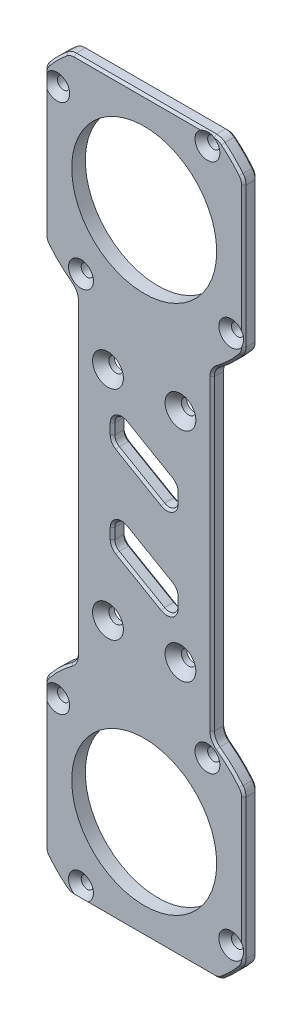
from build123d import *

# Parameters (mm, degrees)
SKETCH_1_R                     = 15.25
EXTRUDE_1_DEPTH                = 3
FILLET_1_R                     = 3
HOLE_WIZARD_M2_5_1_D           = 2.7
HOLE_WIZARD_M2_5_1_DEPTH       = 3
HOLE_WIZARD_M2_5_1_CSINK_D     = 5.5
HOLE_WIZARD_M2_5_1_CSINK_ANGLE = 90
HOLE_WIZARD_M2_5_1_TIP         = 0.811161836
CUT_EXTRUDE_1_DEPTH            = 10
FILLET_2_R                     = 2
HOLE_WIZARD_M3_2_D             = 3.2
HOLE_WIZARD_M3_2_DEPTH         = 3
HOLE_WIZARD_M3_2_CSINK_D       = 6.8
HOLE_WIZARD_M3_2_CSINK_ANGLE   = 90
HOLE_WIZARD_M3_2_TIP           = 0.96137699
SKETCH_8_R                     = 16
CUT_EXTRUDE_2_DEPTH            = 10
CHAMFER_1_SIZE                 = 0.5
CHAMFER_2_SIZE                 = 0.5


with BuildPart() as part:
    # 草图1 → 凸台-拉伸1 (new body)
    # profile 1 of 7: a face of its own
    with BuildSketch(Plane.XY):
        with BuildLine():
            ThreePointArc((15, 35.451138857), (0, 31), (-15, 35.451138857))
            Line((-15, 35.451138857), (-15, -35.451138857))
            ThreePointArc((-15, -35.451138857), (0, -31), (15, -35.451138857))
            Line((15, -35.451138857), (15, 35.451138857))
        make_face()
    # profile 2 of 7: a face of its own
    with BuildSketch(Plane.XY):
        with BuildLine():
            ThreePointArc((15, 35.451138857), (15.758728611, 35.963086445), (16.5, 36.5))
            Line((16.5, 36.5), (15, 36.5))
            Line((15, 36.5), (15, 35.451138857))
        make_face()
    # profile 3 of 7: a face of its own
    with BuildSketch(Plane.XY):
        with BuildLine():
            Line((-15, 36.5), (-16.5, 36.5))
            ThreePointArc((-16.5, 36.5), (-15.758728611, 35.963086445), (-15, 35.451138857))
            Line((-15, 35.451138857), (-15, 36.5))
        make_face()
    # profile 4 of 7: a face of its own
    with BuildSketch(Plane.XY):
        with BuildLine():
            Line((-15, -36.5), (-15, -35.451138857))
            ThreePointArc((-15, -35.451138857), (-15.758728611, -35.963086445), (-16.5, -36.5))
            Line((-16.5, -36.5), (-15, -36.5))
        make_face()
    # profile 5 of 7: a face of its own
    with BuildSketch(Plane.XY):
        with BuildLine():
            ThreePointArc((16.5, -36.5), (15.758728611, -35.963086445), (15, -35.451138857))
            Line((15, -35.451138857), (15, -36.5))
            Line((15, -36.5), (16.5, -36.5))
        make_face()
    # profile 6 of 7: a face of its own
    with BuildSketch(Plane.XY):
        with BuildLine():
            ThreePointArc((15, -35.451138857), (0, -31), (-15, -35.451138857))
            Line((-15, -35.451138857), (-15, -36.5))
            Line((-15, -36.5), (-16.5, -36.5))
            ThreePointArc((-16.5, -36.5), (-19.445436483, -39.054563517), (-22, -42))
            Line((-22, -42), (-22, -75))
            ThreePointArc((-22, -75), (-19.445436483, -77.945436483), (-16.5, -80.5))
            Line((-16.5, -80.5), (16.5, -80.5))
            ThreePointArc((16.5, -80.5), (19.445436483, -77.945436483), (22, -75))
            Line((22, -75), (22, -42))
            ThreePointArc((22, -42), (19.445436483, -39.054563517), (16.5, -36.5))
            Line((16.5, -36.5), (15, -36.5))
            Line((15, -36.5), (15, -35.451138857))
        make_face()
        with Locations((0, -58.5)):
            Circle(SKETCH_1_R, mode=Mode.SUBTRACT)
    # profile 7 of 7: a face of its own
    with BuildSketch(Plane.XY):
        with BuildLine():
            Line((16.5, 80.5), (-16.5, 80.5))
            ThreePointArc((-16.5, 80.5), (-19.445436483, 77.945436483), (-22, 75))
            Line((-22, 75), (-22, 42))
            ThreePointArc((-22, 42), (-19.445436483, 39.054563517), (-16.5, 36.5))
            Line((-16.5, 36.5), (-15, 36.5))
            Line((-15, 36.5), (-15, 35.451138857))
            ThreePointArc((-15, 35.451138857), (0, 31), (15, 35.451138857))
            Line((15, 35.451138857), (15, 36.5))
            Line((15, 36.5), (16.5, 36.5))
            ThreePointArc((16.5, 36.5), (19.445436483, 39.054563517), (22, 42))
            Line((22, 42), (22, 75))
            ThreePointArc((22, 75), (19.445436483, 77.945436483), (16.5, 80.5))
        make_face()
        with Locations((0, 58.5)):
            Circle(SKETCH_1_R, mode=Mode.SUBTRACT)
    extrude(amount=EXTRUDE_1_DEPTH)

    # 圆角1
    fillet_1_edges = [part.edges().sort_by_distance(p)[0] for p in [
        (-22, 42, 1.5),
        (-22, 75, 1.5),
        (-16.5, 80.5, 1.5),
        (16.5, 80.5, 1.5),
        (22, 75, 1.5),
        (22, 42, 1.5),
        (15, 35.451138857, 1.5),
        (15, -35.451138857, 1.5),
        (22, -42, 1.5),
        (22, -75, 1.5),
        (16.5, -80.5, 1.5),
        (-16.5, -80.5, 1.5),
        (-22, -75, 1.5),
        (-22, -42, 1.5),
        (-15, -35.451138857, 1.5),
        (-15, 35.451138857, 1.5),
    ]]
    fillet(fillet_1_edges, radius=FILLET_1_R)

    # M2.5 十字槽半沉头木螺钉的锥形沉头孔1
    with Locations(Plane.XY.offset(3)):
        with Locations((-13.959899742, 39.285846384), (13.959899742, -39.285846384), (19.214153616, -72.459899742), (-13.959899742, -77.714153616), (-19.214153616, -44.540100258), (19.214153616, 44.540100258), (13.959899742, 77.714153616), (-19.214153616, 72.459899742)):
            CounterSinkHole(HOLE_WIZARD_M2_5_1_D / 2, HOLE_WIZARD_M2_5_1_CSINK_D / 2, depth=HOLE_WIZARD_M2_5_1_DEPTH, counter_sink_angle=HOLE_WIZARD_M2_5_1_CSINK_ANGLE)
            with Locations((0, 0, -(HOLE_WIZARD_M2_5_1_DEPTH + HOLE_WIZARD_M2_5_1_TIP / 2))):  # 118° drill point
                Cone(0, HOLE_WIZARD_M2_5_1_D / 2, HOLE_WIZARD_M2_5_1_TIP, mode=Mode.SUBTRACT)

    # 草图5 → 切除-拉伸1 (cut)
    with BuildSketch(Plane.XY.offset(3)):
        Polygon((7, 9.422649731), (-7, 17.505553499), (-7, 10.577350269), (7, 2.494446501), align=None)
        Polygon((-7, -2.494446501), (-7, -9.422649731), (7, -17.505553499), (7, -10.577350269), align=None)
    extrude(amount=-CUT_EXTRUDE_1_DEPTH, mode=Mode.SUBTRACT)

    # 圆角2
    fillet_2_edges = [part.edges().sort_by_distance(p)[0] for p in [
        (-7, 10.577350269, 1.5),
        (-7, 17.505553499, 1.5),
        (7, 9.422649731, 1.5),
        (7, 2.494446501, 1.5),
        (-7, -2.494446501, 1.5),
        (7, -10.577350269, 1.5),
        (7, -17.505553499, 1.5),
        (-7, -9.422649731, 1.5),
    ]]
    fillet(fillet_2_edges, radius=FILLET_2_R)

    # M3 十字槽半沉头木螺钉的锥形沉头孔2
    with Locations(Plane.XY.offset(3)):
        with Locations((-8, -24), (8, 24), (-8, 24), (8, -24)):
            CounterSinkHole(HOLE_WIZARD_M3_2_D / 2, HOLE_WIZARD_M3_2_CSINK_D / 2, depth=HOLE_WIZARD_M3_2_DEPTH, counter_sink_angle=HOLE_WIZARD_M3_2_CSINK_ANGLE)
            with Locations((0, 0, -(HOLE_WIZARD_M3_2_DEPTH + HOLE_WIZARD_M3_2_TIP / 2))):  # 118° drill point
                Cone(0, HOLE_WIZARD_M3_2_D / 2, HOLE_WIZARD_M3_2_TIP, mode=Mode.SUBTRACT)

    # 草图8 → 切除-拉伸2 (cut)
    with BuildSketch(Plane.XY.offset(3)):
        with Locations((0, 58.5)):
            Circle(SKETCH_8_R)
        with Locations((0, -58.5)):
            Circle(SKETCH_8_R)
    extrude(amount=-CUT_EXTRUDE_2_DEPTH, mode=Mode.SUBTRACT)

    # 倒角1
    # the kernel refuses this chamfer: 0.5 mm, written as the material it takes off along each edge
    with BuildSketch(Plane(origin=(19, 43.032291702, 3), x_dir=(1, 0, 0), z_dir=(0, 1, 0))) as chamfer_1_piece_1:
        Polygon((3, CHAMFER_1_SIZE), (3 - CHAMFER_1_SIZE, 0), (3, 0), align=None)
    revolve(axis=Axis((19, 43.032291702, 3), (0, 0, -1)), revolution_arc=39.148687642, mode=Mode.SUBTRACT)
    with BuildSketch(Plane(origin=(-19, 43.032291702, 3), x_dir=(-1, 0, 0), z_dir=(0, 1, 0))) as chamfer_1_piece_2:
        Polygon((3, -CHAMFER_1_SIZE), (3 - CHAMFER_1_SIZE, 0), (3, 0), align=None)
    revolve(axis=Axis((-19, 43.032291702, 3), (0, 0, 1)), revolution_arc=39.148687642, mode=Mode.SUBTRACT)
    with BuildSketch(Plane(origin=(-19, -43.032291702, 3), x_dir=(-1, 0, 0), z_dir=(0, -1, 0))) as chamfer_1_piece_3:
        Polygon((3, CHAMFER_1_SIZE), (3 - CHAMFER_1_SIZE, 0), (3, 0), align=None)
    revolve(axis=Axis((-19, -43.032291702, 3), (0, 0, -1)), revolution_arc=39.148687642, mode=Mode.SUBTRACT)
    with BuildSketch(Plane(origin=(-19, -73.967708298, 3), x_dir=(-0.775510204081634, -0.6313350325819584, 0), z_dir=(0.6313350325819584, -0.775510204081634, 0))) as chamfer_1_piece_4:
        Polygon((3, CHAMFER_1_SIZE), (3 - CHAMFER_1_SIZE, 0), (3, 0), align=None)
    revolve(axis=Axis((-19, -73.967708298, 3), (0, 0, -1)), revolution_arc=39.148687642, mode=Mode.SUBTRACT)
    with BuildSketch(Plane(origin=(-15.467708298, -77.5, 3), x_dir=(0, -1, 0), z_dir=(1, 0, 0))) as chamfer_1_piece_5:
        Polygon((3, CHAMFER_1_SIZE), (3 - CHAMFER_1_SIZE, 0), (3, 0), align=None)
    revolve(axis=Axis((-15.467708298, -77.5, 3), (0, 0, -1)), revolution_arc=39.148687642, mode=Mode.SUBTRACT)
    with BuildSketch(Plane(origin=(15.467708298, -77.5, 3), x_dir=(0.631335032581961, -0.7755102040816318, 0), z_dir=(0.7755102040816318, 0.631335032581961, 0))) as chamfer_1_piece_6:
        Polygon((3, CHAMFER_1_SIZE), (3 - CHAMFER_1_SIZE, 0), (3, 0), align=None)
    revolve(axis=Axis((15.467708298, -77.5, 3), (0, 0, -1)), revolution_arc=39.148687642, mode=Mode.SUBTRACT)
    with BuildSketch(Plane(origin=(19, -73.967708298, 3), x_dir=(1, 0, 0), z_dir=(0, 1, 0))) as chamfer_1_piece_7:
        Polygon((3, CHAMFER_1_SIZE), (3 - CHAMFER_1_SIZE, 0), (3, 0), align=None)
    revolve(axis=Axis((19, -73.967708298, 3), (0, 0, -1)), revolution_arc=39.148687642, mode=Mode.SUBTRACT)
    with BuildSketch(Plane(origin=(19, -43.032291702, 3), x_dir=(0.7755102040815718, 0.6313350325820347, 0), z_dir=(-0.6313350325820347, 0.7755102040815718, 0))) as chamfer_1_piece_8:
        Polygon((3, CHAMFER_1_SIZE), (3 - CHAMFER_1_SIZE, 0), (3, 0), align=None)
    revolve(axis=Axis((19, -43.032291702, 3), (0, 0, -1)), revolution_arc=39.148687642, mode=Mode.SUBTRACT)
    with BuildSketch(Plane(origin=(18, -33.877855496, 0), x_dir=(-0.5901639344262251, -0.8072834263767331, 0), z_dir=(0.8072834263767331, -0.5901639344262251, 0))) as chamfer_1_piece_9:
        Polygon((3 + CHAMFER_1_SIZE, 0), (3, -CHAMFER_1_SIZE), (3, 0), align=None)
    revolve(axis=Axis((18, -33.877855496, 0), (0, 0, -1)), revolution_arc=53.831357652, mode=Mode.SUBTRACT)
    with BuildSketch(Plane(origin=(18, -33.877855496, 3), x_dir=(-0.5901639344262251, -0.8072834263767331, 0), z_dir=(0.8072834263767331, -0.5901639344262251, 0))) as chamfer_1_piece_10:
        Polygon((3, CHAMFER_1_SIZE), (3 + CHAMFER_1_SIZE, 0), (3, 0), align=None)
    revolve(axis=Axis((18, -33.877855496, 3), (0, 0, -1)), revolution_arc=53.831357652, mode=Mode.SUBTRACT)
    with BuildSketch(Plane(origin=(-18, -33.877855496, 0), x_dir=(1, 0, 0), z_dir=(0, 1, 0))) as chamfer_1_piece_11:
        Polygon((3 + CHAMFER_1_SIZE, 0), (3, -CHAMFER_1_SIZE), (3, 0), align=None)
    revolve(axis=Axis((-18, -33.877855496, 0), (0, 0, -1)), revolution_arc=53.831357652, mode=Mode.SUBTRACT)
    with BuildSketch(Plane(origin=(-18, -33.877855496, 3), x_dir=(1, 0, 0), z_dir=(0, 1, 0))) as chamfer_1_piece_12:
        Polygon((3, CHAMFER_1_SIZE), (3 + CHAMFER_1_SIZE, 0), (3, 0), align=None)
    revolve(axis=Axis((-18, -33.877855496, 3), (0, 0, -1)), revolution_arc=53.831357652, mode=Mode.SUBTRACT)
    with BuildSketch(Plane(origin=(-18, 33.877855496, 0), x_dir=(1, 0, 0), z_dir=(0, -1, 0))) as chamfer_1_piece_13:
        Polygon((3 + CHAMFER_1_SIZE, 0), (3, CHAMFER_1_SIZE), (3, 0), align=None)
    revolve(axis=Axis((-18, 33.877855496, 0), (0, 0, 1)), revolution_arc=53.831357652, mode=Mode.SUBTRACT)
    with BuildSketch(Plane(origin=(-18, 33.877855496, 3), x_dir=(1, 0, 0), z_dir=(0, -1, 0))) as chamfer_1_piece_14:
        Polygon((3, -CHAMFER_1_SIZE), (3 + CHAMFER_1_SIZE, 0), (3, 0), align=None)
    revolve(axis=Axis((-18, 33.877855496, 3), (0, 0, 1)), revolution_arc=53.831357652, mode=Mode.SUBTRACT)
    with BuildSketch(Plane(origin=(18, 33.877855496, 0), x_dir=(-0.5901639344262251, 0.8072834263767331, 0), z_dir=(0.8072834263767331, 0.5901639344262251, 0))) as chamfer_1_piece_15:
        Polygon((3 + CHAMFER_1_SIZE, 0), (3, CHAMFER_1_SIZE), (3, 0), align=None)
    revolve(axis=Axis((18, 33.877855496, 0), (0, 0, 1)), revolution_arc=53.831357652, mode=Mode.SUBTRACT)
    with BuildSketch(Plane(origin=(18, 33.877855496, 3), x_dir=(-0.590163934426224, 0.8072834263767339, 0), z_dir=(0.8072834263767339, 0.590163934426224, 0))) as chamfer_1_piece_16:
        Polygon((3, -CHAMFER_1_SIZE), (3 + CHAMFER_1_SIZE, 0), (3, 0), align=None)
    revolve(axis=Axis((18, 33.877855496, 3), (0, 0, 1)), revolution_arc=53.831357652, mode=Mode.SUBTRACT)
    with BuildSketch(Plane(origin=(15, -33.877855496, 0), x_dir=(-0.9996219169112968, 0, -0.02749587661058639), z_dir=(0, 1, 0)), Plane(origin=(15, -33.877855496, 3), x_dir=(0.027495876610585623, 0, -0.9996219169112968), z_dir=(0, 1, 0)), Plane(origin=(-15, 33.877855496, 0), x_dir=(0.9996219169112968, 0, -0.02749587661058639), z_dir=(0, -1, 0)), Plane(origin=(-15, 33.877855496, 3), x_dir=(-0.027495876610585623, 0, -0.9996219169112968), z_dir=(0, -1, 0))) as chamfer_1_piece_17:
        Polygon((CHAMFER_1_SIZE * 0.999621916911, CHAMFER_1_SIZE * 0.0274958766106), (-CHAMFER_1_SIZE * 0.0274958766106, CHAMFER_1_SIZE * 0.999621916911), (0, 0), align=None)
    extrude(amount=67.755710991, mode=Mode.SUBTRACT)
    with BuildSketch(Plane(origin=(0, -58.5, 0), x_dir=(0.590163934426223, 0.8072834263767347, 0), z_dir=(-0.8072834263767347, 0.590163934426223, 0))) as chamfer_1_piece_18:
        Polygon((27.5 - CHAMFER_1_SIZE, 0), (27.5, -CHAMFER_1_SIZE), (27.5, 0), align=None)
    revolve(axis=Axis((0, -58.5, 0), (0, 0, -1)), revolution_arc=14.68267001, mode=Mode.SUBTRACT)
    with BuildSketch(Plane(origin=(0, -58.5, 3), x_dir=(0.7755102040816187, 0.6313350325819771, 0), z_dir=(0.6313350325819771, -0.7755102040816187, 0))) as chamfer_1_piece_19:
        Polygon((27.5, -CHAMFER_1_SIZE), (27.5 - CHAMFER_1_SIZE, 0), (27.5, 0), align=None)
    revolve(axis=Axis((0, -58.5, 3), (0, 0, 1)), revolution_arc=14.68267001, mode=Mode.SUBTRACT)
    with BuildSketch(Plane(origin=(0, 58.5, 0), x_dir=(-0.7755102040816295, -0.6313350325819638, 0), z_dir=(-0.6313350325819638, 0.7755102040816295, 0))) as chamfer_1_piece_20:
        Polygon((27.5 - CHAMFER_1_SIZE, 0), (27.5, CHAMFER_1_SIZE), (27.5, 0), align=None)
    revolve(axis=Axis((0, 58.5, 0), (0, 0, 1)), revolution_arc=14.68267001, mode=Mode.SUBTRACT)
    with BuildSketch(Plane(origin=(-22, 73.967708298, 0), x_dir=(0.9996219169112968, 0, -0.027495876610586292), z_dir=(0, -1, 0)), Plane(origin=(15.467708298, 80.5, 0), x_dir=(0, -0.9996219169112968, -0.027495876610586483), z_dir=(-1, 0, 0)), Plane(origin=(22, 43.032291702, 0), x_dir=(-0.9996219169112968, 0, -0.027495876610586292), z_dir=(0, 1, 0)), Plane(origin=(22, -73.967708298, 0), x_dir=(-0.9996219169112968, 0, -0.027495876610586292), z_dir=(0, 1, 0)), Plane(origin=(-15.467708298, -80.5, 0), x_dir=(0, 0.9996219169112968, -0.027495876610586483), z_dir=(1, 0, 0)), Plane(origin=(-22, -43.032291702, 0), x_dir=(0.9996219169112968, 0, -0.027495876610586292), z_dir=(0, -1, 0)), Plane(origin=(22, -73.967708298, 3), x_dir=(0.02749587661058907, 0, -0.9996219169112965), z_dir=(0, 1, 0)), Plane(origin=(-22, -43.032291702, 3), x_dir=(-0.02749587661058907, 0, -0.9996219169112965), z_dir=(0, -1, 0)), Plane(origin=(-15.467708298, -80.5, 3), x_dir=(0, -0.02749587661058217, -0.9996219169112968), z_dir=(1, 0, 0)), Plane(origin=(22, 43.032291702, 3), x_dir=(0.02749587661058907, 0, -0.9996219169112965), z_dir=(0, 1, 0)), Plane(origin=(15.467708298, 80.5, 3), x_dir=(0, 0.02749587661058217, -0.9996219169112968), z_dir=(-1, 0, 0)), Plane(origin=(-22, 73.967708298, 3), x_dir=(-0.02749587661058907, 0, -0.9996219169112965), z_dir=(0, -1, 0))) as chamfer_1_piece_21:
        Polygon((CHAMFER_1_SIZE * 0.999621916911, CHAMFER_1_SIZE * 0.0274958766106), (-CHAMFER_1_SIZE * 0.0274958766106, CHAMFER_1_SIZE * 0.999621916911), (0, 0), align=None)
    extrude(amount=30.935416597, mode=Mode.SUBTRACT)
    with BuildSketch(Plane(origin=(0, 58.5, 0), x_dir=(-0.6313350325819609, 0.775510204081632, 0), z_dir=(0.775510204081632, 0.6313350325819609, 0))) as chamfer_1_piece_22:
        Polygon((27.5 - CHAMFER_1_SIZE, 0), (27.5, CHAMFER_1_SIZE), (27.5, 0), align=None)
    revolve(axis=Axis((0, 58.5, 0), (0, 0, 1)), revolution_arc=11.702624715, mode=Mode.SUBTRACT)
    with BuildSketch(Plane(origin=(0, 58.5, 0), x_dir=(0.775510204081632, 0.6313350325819607, 0), z_dir=(0.6313350325819607, -0.775510204081632, 0))) as chamfer_1_piece_23:
        Polygon((27.5 - CHAMFER_1_SIZE, 0), (27.5, CHAMFER_1_SIZE), (27.5, 0), align=None)
    revolve(axis=Axis((0, 58.5, 0), (0, 0, 1)), revolution_arc=11.702624715, mode=Mode.SUBTRACT)
    with BuildSketch(Plane(origin=(0, 58.5, 0), x_dir=(0.7755102040816085, -0.6313350325819896, 0), z_dir=(0.6313350325819896, 0.7755102040816085, 0))) as chamfer_1_piece_24:
        Polygon((27.5 - CHAMFER_1_SIZE, 0), (27.5, -CHAMFER_1_SIZE), (27.5, 0), align=None)
    revolve(axis=Axis((0, 58.5, 0), (0, 0, -1)), revolution_arc=14.68267001, mode=Mode.SUBTRACT)
    with BuildSketch(Plane(origin=(0, -58.5, 0), x_dir=(0.6313350325819599, -0.7755102040816326, 0), z_dir=(-0.7755102040816326, -0.6313350325819599, 0))) as chamfer_1_piece_25:
        Polygon((27.5 - CHAMFER_1_SIZE, 0), (27.5, CHAMFER_1_SIZE), (27.5, 0), align=None)
    revolve(axis=Axis((0, -58.5, 0), (0, 0, 1)), revolution_arc=11.702624715, mode=Mode.SUBTRACT)
    with BuildSketch(Plane(origin=(0, -58.5, 0), x_dir=(-0.7755102040816325, -0.6313350325819601, 0), z_dir=(-0.6313350325819601, 0.7755102040816325, 0))) as chamfer_1_piece_26:
        Polygon((27.5 - CHAMFER_1_SIZE, 0), (27.5, CHAMFER_1_SIZE), (27.5, 0), align=None)
    revolve(axis=Axis((0, -58.5, 0), (0, 0, 1)), revolution_arc=11.702624715, mode=Mode.SUBTRACT)
    with BuildSketch(Plane(origin=(0, -58.5, 0), x_dir=(-0.5901639344262206, 0.8072834263767363, 0), z_dir=(0.8072834263767363, 0.5901639344262206, 0))) as chamfer_1_piece_27:
        Polygon((27.5 - CHAMFER_1_SIZE, 0), (27.5, CHAMFER_1_SIZE), (27.5, 0), align=None)
    revolve(axis=Axis((0, -58.5, 0), (0, 0, 1)), revolution_arc=14.68267001, mode=Mode.SUBTRACT)
    with BuildSketch(Plane(origin=(-19, 73.967708298, 0), x_dir=(-1, 0, 0), z_dir=(0, -1, 0))) as chamfer_1_piece_28:
        Polygon((3 - CHAMFER_1_SIZE, 0), (3, -CHAMFER_1_SIZE), (3, 0), align=None)
    revolve(axis=Axis((-19, 73.967708298, 0), (0, 0, -1)), revolution_arc=39.148687642, mode=Mode.SUBTRACT)
    with BuildSketch(Plane(origin=(-15.467708298, 77.5, 0), x_dir=(-0.631335032581961, 0.7755102040816318, 0), z_dir=(-0.7755102040816318, -0.631335032581961, 0))) as chamfer_1_piece_29:
        Polygon((3 - CHAMFER_1_SIZE, 0), (3, -CHAMFER_1_SIZE), (3, 0), align=None)
    revolve(axis=Axis((-15.467708298, 77.5, 0), (0, 0, -1)), revolution_arc=39.148687642, mode=Mode.SUBTRACT)
    with BuildSketch(Plane(origin=(15.467708298, 77.5, 0), x_dir=(0, 1, 0), z_dir=(-1, 0, 0))) as chamfer_1_piece_30:
        Polygon((3 - CHAMFER_1_SIZE, 0), (3, -CHAMFER_1_SIZE), (3, 0), align=None)
    revolve(axis=Axis((15.467708298, 77.5, 0), (0, 0, -1)), revolution_arc=39.148687642, mode=Mode.SUBTRACT)
    with BuildSketch(Plane(origin=(19, 73.967708298, 0), x_dir=(0.7755102040816302, 0.631335032581963, 0), z_dir=(-0.631335032581963, 0.7755102040816302, 0))) as chamfer_1_piece_31:
        Polygon((3 - CHAMFER_1_SIZE, 0), (3, -CHAMFER_1_SIZE), (3, 0), align=None)
    revolve(axis=Axis((19, 73.967708298, 0), (0, 0, -1)), revolution_arc=39.148687642, mode=Mode.SUBTRACT)
    with BuildSketch(Plane(origin=(19, 43.032291702, 0), x_dir=(1, 0, 0), z_dir=(0, 1, 0))) as chamfer_1_piece_32:
        Polygon((3 - CHAMFER_1_SIZE, 0), (3, -CHAMFER_1_SIZE), (3, 0), align=None)
    revolve(axis=Axis((19, 43.032291702, 0), (0, 0, -1)), revolution_arc=39.148687642, mode=Mode.SUBTRACT)
    with BuildSketch(Plane(origin=(-19, 43.032291702, 0), x_dir=(-1, 0, 0), z_dir=(0, 1, 0))) as chamfer_1_piece_33:
        Polygon((3 - CHAMFER_1_SIZE, 0), (3, CHAMFER_1_SIZE), (3, 0), align=None)
    revolve(axis=Axis((-19, 43.032291702, 0), (0, 0, 1)), revolution_arc=39.148687642, mode=Mode.SUBTRACT)
    with BuildSketch(Plane(origin=(-19, -43.032291702, 0), x_dir=(-1, 0, 0), z_dir=(0, -1, 0))) as chamfer_1_piece_34:
        Polygon((3 - CHAMFER_1_SIZE, 0), (3, -CHAMFER_1_SIZE), (3, 0), align=None)
    revolve(axis=Axis((-19, -43.032291702, 0), (0, 0, -1)), revolution_arc=39.148687642, mode=Mode.SUBTRACT)
    with BuildSketch(Plane(origin=(-19, -73.967708298, 0), x_dir=(-0.775510204081634, -0.6313350325819584, 0), z_dir=(0.6313350325819584, -0.775510204081634, 0))) as chamfer_1_piece_35:
        Polygon((3 - CHAMFER_1_SIZE, 0), (3, -CHAMFER_1_SIZE), (3, 0), align=None)
    revolve(axis=Axis((-19, -73.967708298, 0), (0, 0, -1)), revolution_arc=39.148687642, mode=Mode.SUBTRACT)
    with BuildSketch(Plane(origin=(-15.467708298, -77.5, 0), x_dir=(0, -1, 0), z_dir=(1, 0, 0))) as chamfer_1_piece_36:
        Polygon((3 - CHAMFER_1_SIZE, 0), (3, -CHAMFER_1_SIZE), (3, 0), align=None)
    revolve(axis=Axis((-15.467708298, -77.5, 0), (0, 0, -1)), revolution_arc=39.148687642, mode=Mode.SUBTRACT)
    with BuildSketch(Plane(origin=(15.467708298, -77.5, 0), x_dir=(0.631335032581961, -0.7755102040816318, 0), z_dir=(0.7755102040816318, 0.631335032581961, 0))) as chamfer_1_piece_37:
        Polygon((3 - CHAMFER_1_SIZE, 0), (3, -CHAMFER_1_SIZE), (3, 0), align=None)
    revolve(axis=Axis((15.467708298, -77.5, 0), (0, 0, -1)), revolution_arc=39.148687642, mode=Mode.SUBTRACT)
    with BuildSketch(Plane(origin=(19, -73.967708298, 0), x_dir=(1, 0, 0), z_dir=(0, 1, 0))) as chamfer_1_piece_38:
        Polygon((3 - CHAMFER_1_SIZE, 0), (3, -CHAMFER_1_SIZE), (3, 0), align=None)
    revolve(axis=Axis((19, -73.967708298, 0), (0, 0, -1)), revolution_arc=39.148687642, mode=Mode.SUBTRACT)
    with BuildSketch(Plane(origin=(19, -43.032291702, 0), x_dir=(0.7755102040815706, 0.6313350325820362, 0), z_dir=(-0.6313350325820362, 0.7755102040815706, 0))) as chamfer_1_piece_39:
        Polygon((3 - CHAMFER_1_SIZE, 0), (3, -CHAMFER_1_SIZE), (3, 0), align=None)
    revolve(axis=Axis((19, -43.032291702, 0), (0, 0, -1)), revolution_arc=39.148687642, mode=Mode.SUBTRACT)
    with BuildSketch(Plane(origin=(0, 58.5, 3), x_dir=(-0.5901639344262302, -0.8072834263767295, 0), z_dir=(0.8072834263767295, -0.5901639344262302, 0))) as chamfer_1_piece_40:
        Polygon((27.5, CHAMFER_1_SIZE), (27.5 - CHAMFER_1_SIZE, 0), (27.5, 0), align=None)
    revolve(axis=Axis((0, 58.5, 3), (0, 0, -1)), revolution_arc=14.68267001, mode=Mode.SUBTRACT)
    with BuildSketch(Plane(origin=(0, -58.5, 3), x_dir=(-0.7755102040816065, 0.6313350325819921, 0), z_dir=(-0.6313350325819921, -0.7755102040816065, 0))) as chamfer_1_piece_41:
        Polygon((27.5, CHAMFER_1_SIZE), (27.5 - CHAMFER_1_SIZE, 0), (27.5, 0), align=None)
    revolve(axis=Axis((0, -58.5, 3), (0, 0, -1)), revolution_arc=14.68267001, mode=Mode.SUBTRACT)
    with BuildSketch(Plane(origin=(0, -58.5, 3), x_dir=(-0.7755102040816325, -0.6313350325819601, 0), z_dir=(-0.6313350325819601, 0.7755102040816325, 0))) as chamfer_1_piece_42:
        Polygon((27.5, -CHAMFER_1_SIZE), (27.5 - CHAMFER_1_SIZE, 0), (27.5, 0), align=None)
    revolve(axis=Axis((0, -58.5, 3), (0, 0, 1)), revolution_arc=11.702624715, mode=Mode.SUBTRACT)
    with BuildSketch(Plane(origin=(0, -58.5, 3), x_dir=(0.6313350325819599, -0.7755102040816326, 0), z_dir=(-0.7755102040816326, -0.6313350325819599, 0))) as chamfer_1_piece_43:
        Polygon((27.5, -CHAMFER_1_SIZE), (27.5 - CHAMFER_1_SIZE, 0), (27.5, 0), align=None)
    revolve(axis=Axis((0, -58.5, 3), (0, 0, 1)), revolution_arc=11.702624715, mode=Mode.SUBTRACT)
    with BuildSketch(Plane(origin=(0, 58.5, 3), x_dir=(0.5901639344262235, -0.8072834263767343, 0), z_dir=(-0.8072834263767343, -0.5901639344262235, 0))) as chamfer_1_piece_44:
        Polygon((27.5, -CHAMFER_1_SIZE), (27.5 - CHAMFER_1_SIZE, 0), (27.5, 0), align=None)
    revolve(axis=Axis((0, 58.5, 3), (0, 0, 1)), revolution_arc=14.68267001, mode=Mode.SUBTRACT)
    with BuildSketch(Plane(origin=(0, 58.5, 3), x_dir=(0.775510204081632, 0.6313350325819607, 0), z_dir=(0.6313350325819607, -0.775510204081632, 0))) as chamfer_1_piece_45:
        Polygon((27.5, -CHAMFER_1_SIZE), (27.5 - CHAMFER_1_SIZE, 0), (27.5, 0), align=None)
    revolve(axis=Axis((0, 58.5, 3), (0, 0, 1)), revolution_arc=11.702624715, mode=Mode.SUBTRACT)
    with BuildSketch(Plane(origin=(0, 58.5, 3), x_dir=(-0.6313350325819609, 0.775510204081632, 0), z_dir=(0.775510204081632, 0.6313350325819609, 0))) as chamfer_1_piece_46:
        Polygon((27.5, -CHAMFER_1_SIZE), (27.5 - CHAMFER_1_SIZE, 0), (27.5, 0), align=None)
    revolve(axis=Axis((0, 58.5, 3), (0, 0, 1)), revolution_arc=11.702624715, mode=Mode.SUBTRACT)
    with BuildSketch(Plane(origin=(-19, 73.967708298, 3), x_dir=(-1, 0, 0), z_dir=(0, -1, 0))) as chamfer_1_piece_47:
        Polygon((3, CHAMFER_1_SIZE), (3 - CHAMFER_1_SIZE, 0), (3, 0), align=None)
    revolve(axis=Axis((-19, 73.967708298, 3), (0, 0, -1)), revolution_arc=39.148687642, mode=Mode.SUBTRACT)
    with BuildSketch(Plane(origin=(-15.467708298, 77.5, 3), x_dir=(-0.631335032581961, 0.7755102040816318, 0), z_dir=(-0.7755102040816318, -0.631335032581961, 0))) as chamfer_1_piece_48:
        Polygon((3, CHAMFER_1_SIZE), (3 - CHAMFER_1_SIZE, 0), (3, 0), align=None)
    revolve(axis=Axis((-15.467708298, 77.5, 3), (0, 0, -1)), revolution_arc=39.148687642, mode=Mode.SUBTRACT)
    with BuildSketch(Plane(origin=(15.467708298, 77.5, 3), x_dir=(0, 1, 0), z_dir=(-1, 0, 0))) as chamfer_1_piece_49:
        Polygon((3, CHAMFER_1_SIZE), (3 - CHAMFER_1_SIZE, 0), (3, 0), align=None)
    revolve(axis=Axis((15.467708298, 77.5, 3), (0, 0, -1)), revolution_arc=39.148687642, mode=Mode.SUBTRACT)
    with BuildSketch(Plane(origin=(19, 73.967708298, 3), x_dir=(0.7755102040816302, 0.631335032581963, 0), z_dir=(-0.631335032581963, 0.7755102040816302, 0))) as chamfer_1_piece_50:
        Polygon((3, CHAMFER_1_SIZE), (3 - CHAMFER_1_SIZE, 0), (3, 0), align=None)
    revolve(axis=Axis((19, 73.967708298, 3), (0, 0, -1)), revolution_arc=39.148687642, mode=Mode.SUBTRACT)

    # 倒角2
    chamfer_2_edges = [part.edges().sort_by_distance(p)[0] for p in [
        (1, -7.113248654, 3),
        (1, -7.113248654, 0),
        (7, -12.886751346, 3),
        (7, -12.886751346, 0),
        (-1, -12.886751346, 3),
        (-1, -12.886751346, 0),
        (-7, -7.113248654, 3),
        (-7, -7.113248654, 0),
        (-1, 7.113248654, 3),
        (-1, 7.113248654, 0),
        (-7, 12.886751346, 3),
        (-7, 12.886751346, 0),
        (7, 7.113248654, 3),
        (7, 7.113248654, 0),
        (1, 12.886751346, 3),
        (1, 12.886751346, 0),
        (6.732050808, -10.732050808, 3),
        (6.732050808, -10.732050808, 0),
        (6, -15.773502692, 3),
        (6, -15.773502692, 0),
        (-6.732050808, -9.267949192, 3),
        (-6.732050808, -9.267949192, 0),
        (-6, -4.226497308, 3),
        (-6, -4.226497308, 0),
        (-6.732050808, 10.732050808, 3),
        (-6.732050808, 10.732050808, 0),
        (6, 4.226497308, 3),
        (6, 4.226497308, 0),
        (6.732050808, 9.267949192, 3),
        (6.732050808, 9.267949192, 0),
        (-6, 15.773502692, 3),
        (-6, 15.773502692, 0),
    ]]
    chamfer(chamfer_2_edges, length=CHAMFER_2_SIZE)


solid = part.part
